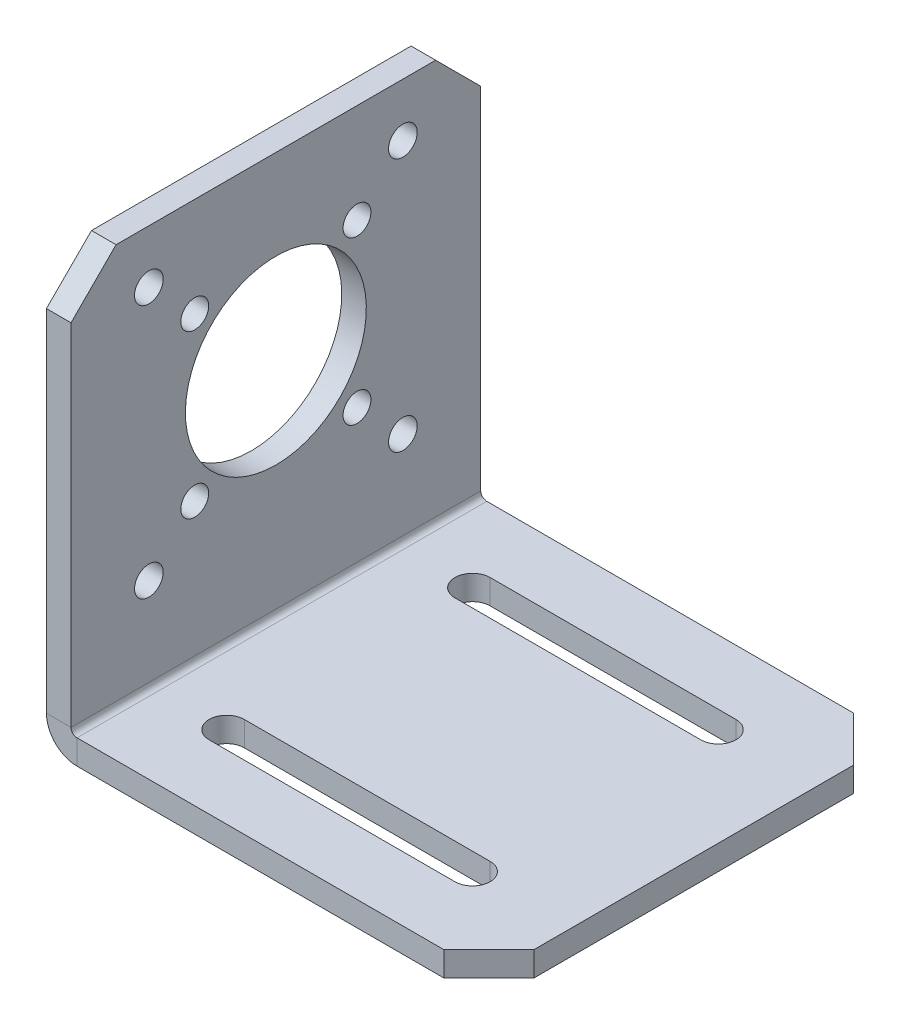
from build123d import *

# Parameters (mm, degrees)
BASE_FLANGE1_DEPTH           = 50
CUT_EXTRUDE1_REACH           = 92.111
SKETCH23_R                   = 11.04
SKETCH23_R_2                 = 1.75
CUT_EXTRUDE2_REACH           = 90.414
CHAMFER1_SIZE                = 5.5
TALADRO_DE_MARGEN_PARA_M31_D = 3.4
MATRIZC1_COUNT               = 4


# Sheet-metal steps are written as plain solids
with BuildPart() as part:
    # Sketch2 → Base-Flange1 (new body)
    with BuildSketch(Plane(origin=(0, 0, 0), x_dir=(-1, 0, 0), z_dir=(0, 0, -1))):
        with BuildLine():
            Line((0, 52), (0, 3.7366))
            ThreePointArc((0, 3.7366), (-1.094424801, 1.094424801), (-3.7366, 0))
            Line((-3.7366, 0), (-54, 0))
            Line((-54, 0), (-54, 3))
            Line((-54, 3), (-3.7366, 3))
            ThreePointArc((-3.7366, 3), (-3.215745145, 3.215745145), (-3, 3.7366))
            Line((-3, 3.7366), (-3, 52))
            Line((-3, 52), (0, 52))
        make_face()
    extrude(amount=BASE_FLANGE1_DEPTH)

    # Sketch23 → Cut-Extrude1 (cut, up to next)
    with BuildSketch(Plane.ZY, mode=Mode.PRIVATE) as cut_extrude1_sk1:
        with Locations(Location((-25, 30, 0), (0, 0, 270))):
            Circle(SKETCH23_R)
    cut_extrude1_tool1 = extrude(cut_extrude1_sk1.sketch, amount=-CUT_EXTRUDE1_REACH, mode=Mode.PRIVATE) & part.part
    # Sketch23 → Cut-Extrude1 (cut, up to next)
    with BuildSketch(Plane.ZY, mode=Mode.PRIVATE) as cut_extrude1_sk2:
        with Locations(Location((-9.5, 45.5, 0), (0, 0, 270))):
            Circle(SKETCH23_R_2)
    cut_extrude1_tool2 = extrude(cut_extrude1_sk2.sketch, amount=-CUT_EXTRUDE1_REACH, mode=Mode.PRIVATE) & part.part
    # Sketch23 → Cut-Extrude1 (cut, up to next)
    with BuildSketch(Plane.ZY, mode=Mode.PRIVATE) as cut_extrude1_sk3:
        with Locations(Location((-9.5, 14.5, 0), (0, 0, 270))):
            Circle(SKETCH23_R_2)
    cut_extrude1_tool3 = extrude(cut_extrude1_sk3.sketch, amount=-CUT_EXTRUDE1_REACH, mode=Mode.PRIVATE) & part.part
    # Sketch23 → Cut-Extrude1 (cut, up to next)
    with BuildSketch(Plane.ZY, mode=Mode.PRIVATE) as cut_extrude1_sk4:
        with Locations(Location((-40.5, 14.5, 0), (0, 0, 270))):
            Circle(SKETCH23_R_2)
    cut_extrude1_tool4 = extrude(cut_extrude1_sk4.sketch, amount=-CUT_EXTRUDE1_REACH, mode=Mode.PRIVATE) & part.part
    # Sketch23 → Cut-Extrude1 (cut, up to next)
    with BuildSketch(Plane.ZY, mode=Mode.PRIVATE) as cut_extrude1_sk5:
        with Locations(Location((-40.5, 45.5, 0), (0, 0, 270))):
            Circle(SKETCH23_R_2)
    cut_extrude1_tool5 = extrude(cut_extrude1_sk5.sketch, amount=-CUT_EXTRUDE1_REACH, mode=Mode.PRIVATE) & part.part
    add(cut_extrude1_tool1.solids().sort_by_distance((0, 30, -25))[0], mode=Mode.SUBTRACT)
    add(cut_extrude1_tool2.solids().sort_by_distance((0, 45.5, -9.5))[0], mode=Mode.SUBTRACT)
    add(cut_extrude1_tool3.solids().sort_by_distance((0, 14.5, -9.5))[0], mode=Mode.SUBTRACT)
    add(cut_extrude1_tool4.solids().sort_by_distance((0, 14.5, -40.5))[0], mode=Mode.SUBTRACT)
    add(cut_extrude1_tool5.solids().sort_by_distance((0, 45.5, -40.5))[0], mode=Mode.SUBTRACT)

    # Sketch24 → Cut-Extrude2 (cut, up to next)
    with BuildSketch(Plane(origin=(0, 3, 0), x_dir=(1, 0, 0), z_dir=(0, 1, 0)), mode=Mode.PRIVATE) as cut_extrude2_sk1:
        with BuildLine():
            Line((42, 7.85), (12, 7.85))
            ThreePointArc((12, 7.85), (9.85, 10), (12, 12.15))
            Line((12, 12.15), (42, 12.15))
            ThreePointArc((42, 12.15), (44.15, 10), (42, 7.85))
        make_face()
    cut_extrude2_tool1 = extrude(cut_extrude2_sk1.sketch, amount=-CUT_EXTRUDE2_REACH, mode=Mode.PRIVATE) & part.part
    # Sketch24 → Cut-Extrude2 (cut, up to next)
    with BuildSketch(Plane(origin=(0, 3, 0), x_dir=(1, 0, 0), z_dir=(0, 1, 0)), mode=Mode.PRIVATE) as cut_extrude2_sk2:
        with BuildLine():
            Line((12, 42.15), (42, 42.15))
            ThreePointArc((42, 42.15), (44.15, 40), (42, 37.85))
            Line((42, 37.85), (12, 37.85))
            ThreePointArc((12, 37.85), (9.85, 40), (12, 42.15))
        make_face()
    cut_extrude2_tool2 = extrude(cut_extrude2_sk2.sketch, amount=-CUT_EXTRUDE2_REACH, mode=Mode.PRIVATE) & part.part
    add(cut_extrude2_tool1.solids().sort_by_distance((27, 3, -10))[0], mode=Mode.SUBTRACT)
    add(cut_extrude2_tool2.solids().sort_by_distance((27, 3, -40))[0], mode=Mode.SUBTRACT)

    # Chamfer1
    chamfer1_edges = [part.edges().sort_by_distance(p)[0] for p in [
        (1.5, 52, -50),
        (54, 1.5, -50),
        (1.5, 52, 0),
        (54, 1.5, 0),
    ]]
    chamfer(chamfer1_edges, length=CHAMFER1_SIZE)

    # Taladro de margen para M31 (through all)
    with Locations(Plane.ZY):
        with Locations((-15.100505063, 39.899494937)):
            taladro_de_margen_para_m31 = Hole(TALADRO_DE_MARGEN_PARA_M31_D / 2)

    # MatrizC1: Taladro de margen para M31 ×4 about axis
    matrizc1_axis = Axis((0, 30, -25), (1, 0, 0))
    for i in range(1, MATRIZC1_COUNT):
        add(taladro_de_margen_para_m31.rotate(matrizc1_axis, i * 360 / MATRIZC1_COUNT), mode=Mode.SUBTRACT)


solid = part.part
